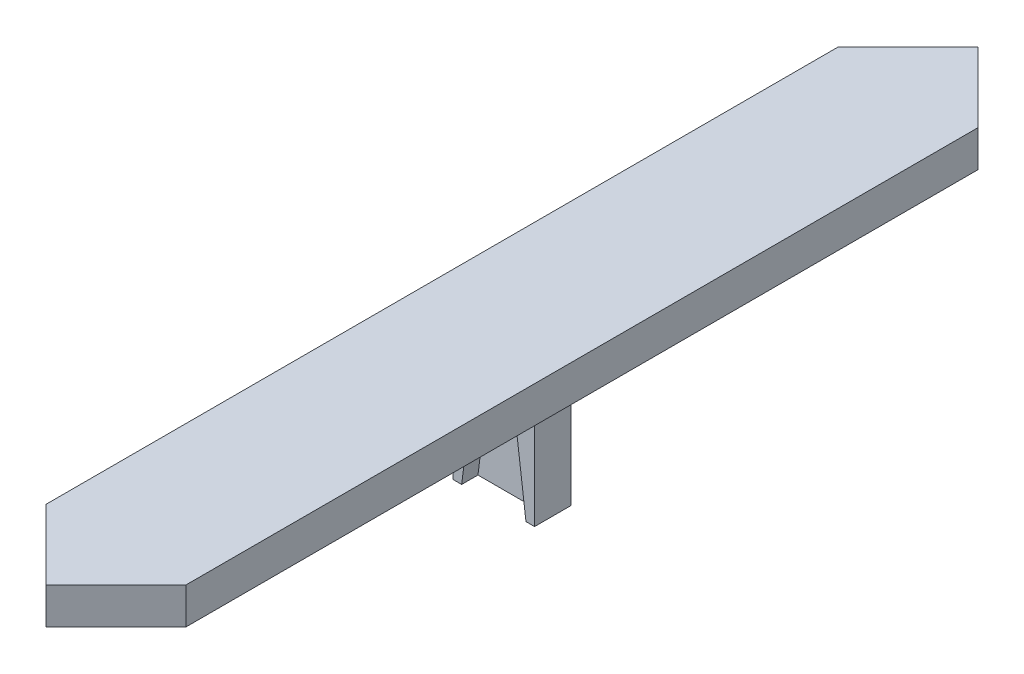
from build123d import *

# Parameters (mm, degrees)
BOSS_EXTRUDE1_DEPTH = 3.125
SKETCH2_W           = 7
SKETCH2_H           = 3.125
BOSS_EXTRUDE2_DEPTH = 10
CUT_EXTRUDE1_DEPTH  = 1.4


with BuildPart() as part:
    # Sketch1 → Boss-Extrude1 (new body)
    with BuildSketch(Plane(origin=(0, 0, 0), x_dir=(1, 0, 0), z_dir=(0, 1, 0))):
        Polygon((0, 0), (6, -6), (6, -74), (0, -80), (-6, -74), (-6, -6), align=None)
    extrude(amount=BOSS_EXTRUDE1_DEPTH)

    # Sketch2 → Boss-Extrude2 (add)
    with BuildSketch(Plane.XZ):
        with Locations((0, 40)):
            Rectangle(SKETCH2_W, SKETCH2_H)
    extrude(amount=BOSS_EXTRUDE2_DEPTH)

    # Sketch3 → Cut-Extrude1 (cut)
    with BuildSketch(Plane.XY.offset(41.5625)):
        with BuildLine():
            Line((3.5, -15.84), (-3.5, -15.84))
            Line((-3.5, -15.84), (-2, -4))
            ThreePointArc((-2, -4), (0, -2), (2, -4))
            Line((2, -4), (3.5, -15.84))
        make_face()
    extrude(amount=-CUT_EXTRUDE1_DEPTH, mode=Mode.SUBTRACT)


solid = part.part
